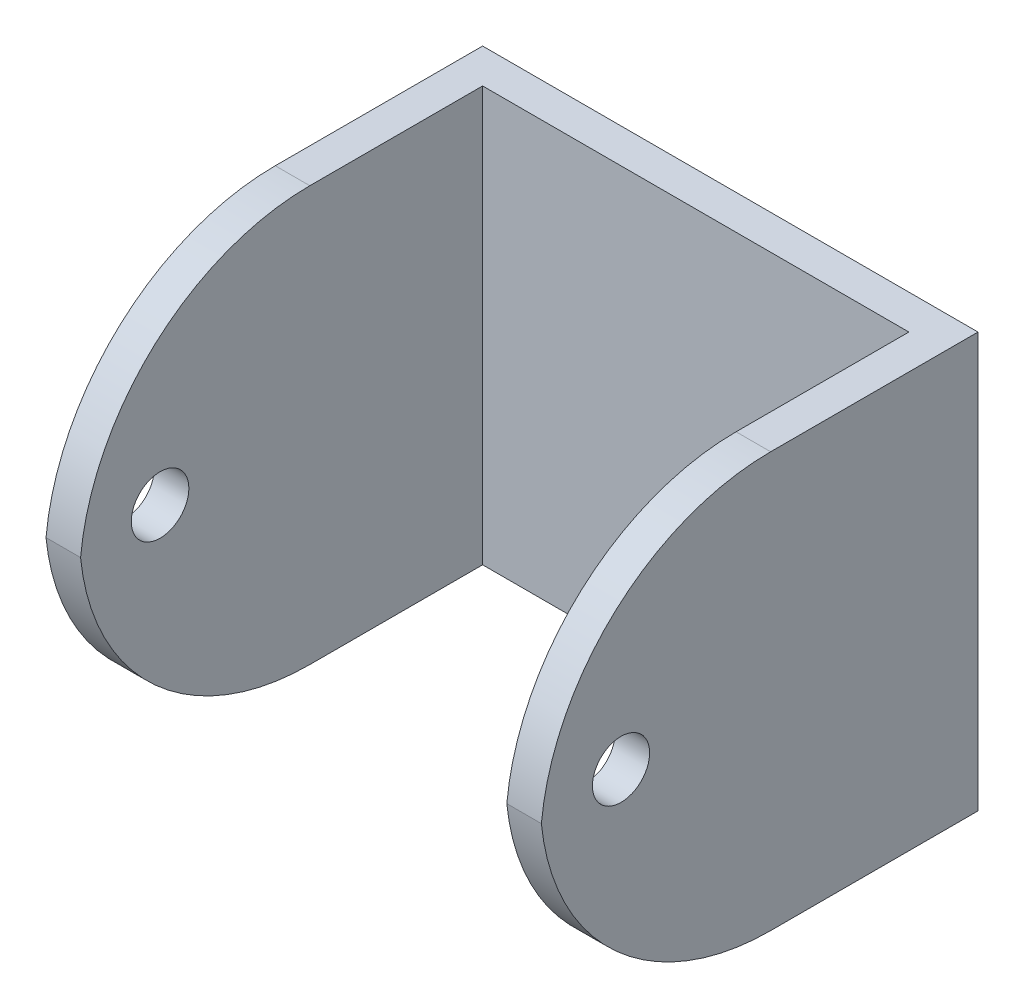
from build123d import *

# Parameters (mm, degrees)
ESQUISSE1_W             = 43
ESQUISSE1_H             = 36
BOSS_EXTRU_1_DEPTH      = 3
ESQUISSE2_W             = 3
ESQUISSE2_H             = 36
BOSS_EXTRU_2_DEPTH      = 25
ESQUISSE3_W             = 3
ESQUISSE3_H             = 36
BOSS_EXTRU_3_DEPTH      = 35
ESQUISSE4_R             = 2.5
ENL_V_MAT_EXTRU_1_DEPTH = 95
CONG_1_R                = 20
ESQUISSE5_W             = 46.070025289
ESQUISSE5_H             = 43.599493682
ENL_V_MAT_EXTRU_2_DEPTH = 95
ESQUISSE6_W             = 3
ESQUISSE6_H             = 36
BOSS_EXTRU_4_DEPTH      = 35
ESQUISSE7_R             = 2.482615241
ENL_V_MAT_EXTRU_3_DEPTH = 35
CONG_2_R                = 20


with BuildPart() as part:
    # Esquisse1 → Boss.-Extru.1 (new body)
    with BuildSketch(Plane.XY):
        with Locations((-52.514246193, 13.599576988)):
            Rectangle(ESQUISSE1_W, ESQUISSE1_H)
    extrude(amount=BOSS_EXTRU_1_DEPTH)

    # Esquisse2 → Boss.-Extru.2 (add)
    with BuildSketch(Plane.XY.offset(3)):
        with Locations((-32.514246193, 13.599576988)):
            Rectangle(ESQUISSE2_W, ESQUISSE2_H)
    extrude(amount=BOSS_EXTRU_2_DEPTH)

    # Esquisse3 → Boss.-Extru.3 (add)
    with BuildSketch(Plane.XY.offset(3)):
        with Locations((-72.514246193, 13.599576988)):
            Rectangle(ESQUISSE3_W, ESQUISSE3_H)
    extrude(amount=BOSS_EXTRU_3_DEPTH)

    # Esquisse4 → Enlèv. mat.-Extru.1 (cut)
    with BuildSketch(Plane.ZY.offset(74.014246193)):
        with Locations(Location((31, 14.099576988, 0), (0, 0, 270))):
            Circle(ESQUISSE4_R)
    extrude(amount=-ENL_V_MAT_EXTRU_1_DEPTH, mode=Mode.SUBTRACT)

    # Congé1
    # the kernel refuses this fillet: 20 mm, written as the material it takes off along each edge
    with BuildSketch(Plane(origin=(-34.014246193, -4.400423012, 28), x_dir=(0, 1, 0), z_dir=(1, 0, 0))) as cong_1_piece_1:
        with BuildLine():
            CenterArc((CONG_1_R, -CONG_1_R), CONG_1_R, 90, 90)
            Line((0, -CONG_1_R), (0, 0))
            Line((0, 0), (CONG_1_R, 0))
        make_face()
    extrude(amount=53, mode=Mode.SUBTRACT)
    with BuildSketch(Plane(origin=(18.985753807, 31.599576988, 28), x_dir=(0, 0, -1), z_dir=(-1, 0, 0))) as cong_1_piece_2:
        with BuildLine():
            CenterArc((CONG_1_R, CONG_1_R), CONG_1_R, 180, 90)
            Line((0, CONG_1_R), (0, 0))
            Line((0, 0), (CONG_1_R, 0))
        make_face()
    extrude(amount=53, mode=Mode.SUBTRACT)
    with BuildSketch(Plane(origin=(-21.014246193, -4.400423012, 38), x_dir=(0, 1, 0), z_dir=(-1, 0, 0))) as cong_1_piece_3:
        with BuildLine():
            CenterArc((CONG_1_R, CONG_1_R), CONG_1_R, 180, 90)
            Line((0, CONG_1_R), (0, 0))
            Line((0, 0), (CONG_1_R, 0))
        make_face()
    extrude(amount=103, mode=Mode.SUBTRACT)
    with BuildSketch(Plane(origin=(-124.014246193, 31.599576988, 38), x_dir=(0, 0, -1), z_dir=(1, 0, 0))) as cong_1_piece_4:
        with BuildLine():
            CenterArc((CONG_1_R, -CONG_1_R), CONG_1_R, 90, 90)
            Line((0, -CONG_1_R), (0, 0))
            Line((0, 0), (CONG_1_R, 0))
        make_face()
    extrude(amount=103, mode=Mode.SUBTRACT)

    # Esquisse5 → Enlèv. mat.-Extru.2 (cut)
    with BuildSketch(Plane.ZY.offset(34.014246193)):
        with Locations((26.035012645, 9.799830147)):
            Rectangle(ESQUISSE5_W, ESQUISSE5_H)
    extrude(amount=-ENL_V_MAT_EXTRU_2_DEPTH, mode=Mode.SUBTRACT)

    # Esquisse6 → Boss.-Extru.4 (add)
    with BuildSketch(Plane.XY.offset(3)):
        with Locations((-32.514246193, 13.599576988)):
            Rectangle(ESQUISSE6_W, ESQUISSE6_H)
    extrude(amount=BOSS_EXTRU_4_DEPTH)

    # Esquisse7 → Enlèv. mat.-Extru.3 (cut)
    with BuildSketch(Plane.ZY.offset(34.014246193)):
        with Locations((30.985935606, 14.217034277)):
            Circle(ESQUISSE7_R)
    extrude(amount=-ENL_V_MAT_EXTRU_3_DEPTH, mode=Mode.SUBTRACT)

    # Congé2
    # the kernel refuses this fillet: 20 mm, written as the material it takes off along each edge
    with BuildSketch(Plane(origin=(-84.014246193, -4.400423012, 38), x_dir=(0, 1, 0), z_dir=(1, 0, 0))) as cong_2_piece_1:
        with BuildLine():
            CenterArc((CONG_2_R, -CONG_2_R), CONG_2_R, 90, 90)
            Line((0, -CONG_2_R), (0, 0))
            Line((0, 0), (CONG_2_R, 0))
        make_face()
    extrude(amount=103, mode=Mode.SUBTRACT)
    with BuildSketch(Plane(origin=(18.985753807, 31.599576988, 38), x_dir=(0, 0, -1), z_dir=(-1, 0, 0))) as cong_2_piece_2:
        with BuildLine():
            CenterArc((CONG_2_R, CONG_2_R), CONG_2_R, 180, 90)
            Line((0, CONG_2_R), (0, 0))
            Line((0, 0), (CONG_2_R, 0))
        make_face()
    extrude(amount=103, mode=Mode.SUBTRACT)


solid = part.part
